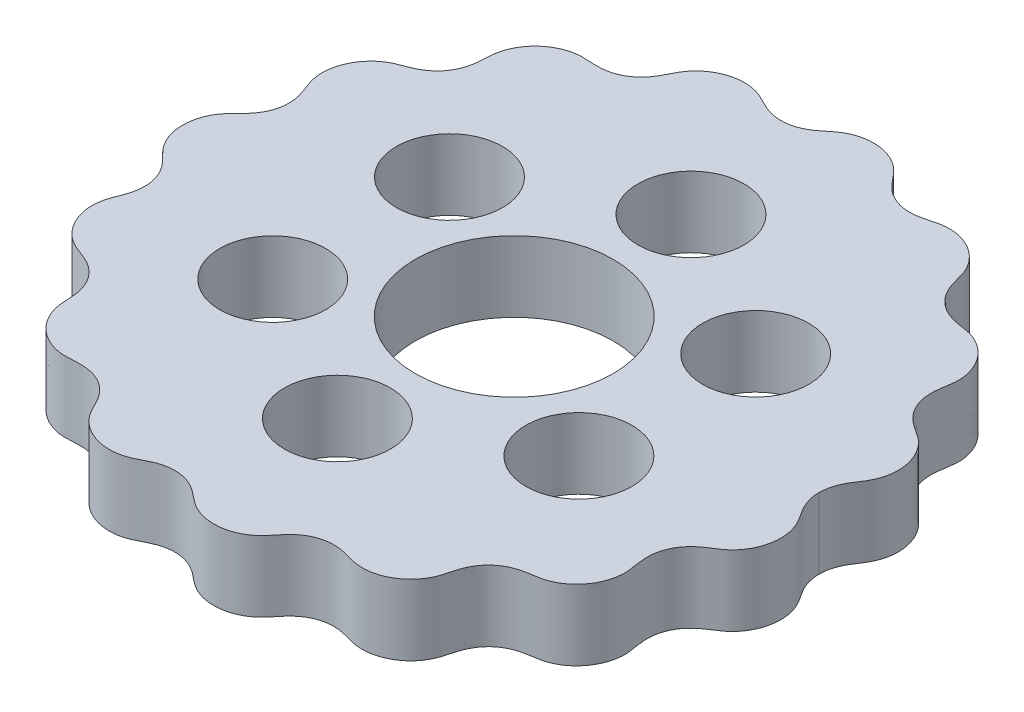
from build123d import *

# Parameters (mm, degrees)
BOSS_EXTRUDE1_DEPTH = 10
SKETCH2_R           = 14
SKETCH2_R_2         = 7.5
CUT_EXTRUDE1_DEPTH  = 10


with BuildPart() as part:
    # Sketch1 → Boss-Extrude1 (new body)
    with BuildSketch(Plane(origin=(0, 0, 0), x_dir=(1, 0, 0), z_dir=(0, 1, 0))):
        with BuildLine():
            add(Edge.make_bspline(
                [(43.125, 0), (43.125, -0.04253376), (43.125842023, -0.105329029), (43.128648775, -0.219501248), (43.135019123, -0.352292602), (43.141932928, -0.454759474), (43.15293713, -0.582006478), (43.169926456, -0.737698323), (43.195057818, -0.920018582), (43.230988459, -1.126003403), (43.274023628, -1.331077263), (43.33656904, -1.585225597), (43.454877118, -1.987246867), (43.659957218, -2.526165865), (44.003257795, -3.208529191), (44.486703726, -3.963009603), (45.011710901, -4.724365647), (45.464881913, -5.566998571), (45.829789729, -6.583473472), (46.037635432, -7.769953603), (46.018876274, -9.108172689), (45.699173049, -10.541997716), (45.13241202, -11.790586356), (44.391420513, -12.821058061), (43.553658534, -13.62486626), (42.686773685, -14.218656762), (41.847173706, -14.723738241), (41.113010158, -15.27010197), (40.356508237, -15.984911286), (39.64401467, -16.920938383), (39.065487742, -18.176194843), (38.821808048, -19.614860862), (38.883740817, -20.808738979), (39.036511831, -21.728716893), (39.149999061, -22.395010733), (39.218485568, -22.931744545), (39.256494717, -23.607184213), (39.20773201, -24.529298073), (38.956646376, -25.675266369), (38.383638085, -26.966438066), (37.491280365, -28.188034586), (36.456233226, -29.112194815), (35.371495342, -29.751280862), (34.300362256, -30.144907835), (33.296839208, -30.340567925), (32.34235617, -30.45668892), (31.455433855, -30.643043045), (30.650677042, -30.910490339), (29.936591375, -31.250491088), (29.11286761, -31.781933535), (28.252053762, -32.581040774), (27.616924672, -33.501658002), (27.196078853, -34.46335063), (26.957088965, -35.223334671), (26.81673532, -35.752261367), (26.683233633, -36.282678413), (26.531216493, -36.808512671), (26.297110502, -37.451705898), (25.883256178, -38.290560319), (25.188270048, -39.256343387), (24.124812446, -40.230448913), (22.778201742, -41.008012636), (21.402888244, -41.44171185), (20.21887944, -41.561053404), (19.285736569, -41.499490672), (18.47628618, -41.357950231), (17.68481965, -41.139805876), (16.656909007, -40.841140025), (15.342614716, -40.657065554), (13.891256715, -40.773177402), (12.591917321, -41.237982668), (11.591762454, -41.868412598), (10.809846945, -42.562675581), (10.205148907, -43.237679616), (9.62724817, -44.006173799), (8.95609046, -44.777447386), (8.079608407, -45.508249162), (6.983789251, -46.128124512), (5.665910241, -46.562416571), (4.161803775, -46.724425993), (2.757108076, -46.575077706), (1.639130281, -46.219541522), (0.816173285, -45.800713485), (0.250230967, -45.430077279), (-0.180351589, -45.102399012), (-0.700634877, -44.670969398), (-1.420974084, -44.078676847), (-2.423935916, -43.428102369), (-3.791697811, -42.919802312), (-5.168044297, -42.793192865), (-6.334915625, -42.942217189), (-7.332207563, -43.239961851), (-8.172458729, -43.602585529), (-9.029663207, -44.077157208), (-9.977356856, -44.531010068), (-11.0923363, -44.854623518), (-12.355278272, -44.98111416), (-13.737494876, -44.845914812), (-15.171813178, -44.390479958), (-16.39183502, -43.692656976), (-17.269283362, -42.922687499), (-17.853346372, -42.213210816), (-18.222154822, -41.649928431), (-18.48392233, -41.179315476), (-18.783866284, -40.577170893), (-19.19551646, -39.74553523), (-19.834531711, -38.742366458), (-20.862240201, -37.71220112), (-22.228604102, -36.923330554), (-23.6346077, -36.548391563), (-24.822884966, -36.496572508), (-25.748927665, -36.55589083), (-26.420372148, -36.597204037), (-26.958818676, -36.605813203), (-27.631039756, -36.568056908), (-28.537496092, -36.416981846), (-29.64303339, -36.04207403), (-30.857376741, -35.334415612), (-31.968954045, -34.319976953), (-32.777148417, -33.190541935), (-33.299075294, -32.033556783), (-33.576307547, -30.906149533), (-33.657106265, -29.85849633), (-33.674717375, -28.878849634), (-33.780801638, -27.969858942), (-34.02159317, -26.957306454), (-34.475969978, -25.872254085), (-35.273790229, -24.743607776), (-36.397871921, -23.813241276), (-37.46276689, -23.269938061), (-38.335876844, -22.94225233), (-38.969647574, -22.707388509), (-39.468716405, -22.498332367), (-40.072668176, -22.193529794), (-40.846862001, -21.690242557), (-41.713754922, -20.899812792), (-42.545441183, -19.757985818), (-43.157191622, -18.374385154), (-43.440020903, -17.015924787), (-43.451106264, -15.75697615), (-43.256448335, -14.632525841), (-42.9240971, -13.665636507), (-42.547488448, -12.78093696), (-42.265303916, -11.9197138), (-42.05495271, -10.89547875), (-42.016706106, -9.908186807), (-42.151176327, -8.933043452), (-42.451756736, -8.004318322), (-42.782221005, -7.303895351), (-43.24001438, -6.582366244), (-43.837169383, -5.861382973), (-44.470557981, -5.254411711), (-45.055286307, -4.678236723), (-45.494411749, -4.152537393), (-45.811419257, -3.706270708), (-46.068393708, -3.268571236), (-46.274068237, -2.849742032), (-46.435847202, -2.455249672), (-46.561708447, -2.09053676), (-46.653497015, -1.76554208), (-46.719145848, -1.483772319), (-46.765092539, -1.247079973), (-46.796615034, -1.056810016), (-46.822884874, -0.865953903), (-46.843904414, -0.673173674), (-46.857699771, -0.506964881), (-46.866240226, -0.363599971), (-46.871167554, -0.236183528), (-46.873795508, -0.132018435), (-46.874781002, -0.061861362), (-46.875, -0.020519481), (-46.875, 0)],
                knots=[0.073379942, 0.073379942, 0.073379942, 0.073379942, 0.073379942, 0.074471538, 0.075017335, 0.075563133, 0.076134945, 0.076706758, 0.077850382, 0.078994007, 0.080137631, 0.081281256, 0.082424881, 0.08471213, 0.089286628, 0.093861126, 0.099069298, 0.104277469, 0.109485641, 0.114693812, 0.122572784, 0.130451757, 0.138511613, 0.146571469, 0.152296032, 0.158020594, 0.163745157, 0.169469719, 0.173712688, 0.177955657, 0.186441594, 0.195001278, 0.203560962, 0.20946737, 0.212420574, 0.215373778, 0.218326982, 0.221280186, 0.227186594, 0.235488461, 0.243790327, 0.251894239, 0.259998151, 0.26556746, 0.271136768, 0.276706077, 0.282275385, 0.286582441, 0.290889497, 0.295196553, 0.299503609, 0.307939116, 0.316374624, 0.319362447, 0.322350271, 0.325338094, 0.328325918, 0.331313742, 0.334301565, 0.340277212, 0.348703072, 0.357128932, 0.365554792, 0.373980652, 0.379956299, 0.382944123, 0.385931946, 0.391907594, 0.397883241, 0.406318748, 0.414754256, 0.423368367, 0.427675423, 0.431982479, 0.437551788, 0.443121096, 0.448690405, 0.454259714, 0.462363625, 0.470467537, 0.478769404, 0.48707127, 0.492977678, 0.495930882, 0.498884086, 0.50183729, 0.504790494, 0.510696902, 0.519256586, 0.527816271, 0.536302208, 0.540545176, 0.544788145, 0.550512708, 0.55623727, 0.561961833, 0.567686395, 0.575746252, 0.583806108, 0.59206794, 0.600329772, 0.606207918, 0.609146991, 0.612086064, 0.615025138, 0.617964211, 0.623842357, 0.632360151, 0.640877945, 0.649395738, 0.657913532, 0.663791678, 0.666730752, 0.669669825, 0.672608898, 0.675547971, 0.681426118, 0.68968795, 0.697949782, 0.706009638, 0.714069494, 0.719794057, 0.725518619, 0.731243182, 0.736967744, 0.741210713, 0.745453681, 0.753939619, 0.762499303, 0.771058987, 0.776965395, 0.779918599, 0.782871803, 0.785825007, 0.788778211, 0.794684619, 0.802986486, 0.811288352, 0.819392264, 0.827496176, 0.833065484, 0.838634793, 0.844204102, 0.84977341, 0.854080466, 0.858387522, 0.867001634, 0.871219387, 0.875437141, 0.879654895, 0.883872649, 0.889848296, 0.895823943, 0.898811766, 0.90179959, 0.904787413, 0.907775237, 0.909881702, 0.911988167, 0.914094632, 0.916201097, 0.917254329, 0.918307562, 0.919360794, 0.920414027, 0.92146726, 0.922520492, 0.923047108, 0.923573725, 0.924100341, 0.924626957, 0.924626957, 0.924626957, 0.924626957, 0.924626957], degree=4))
            add(Edge.make_bspline(
                [(43.125, 0), (43.125, 0.04253376), (43.125842023, 0.105329029), (43.128648775, 0.219501248), (43.135019123, 0.352292602), (43.141932928, 0.454759474), (43.15293713, 0.582006478), (43.169926456, 0.737698323), (43.195057818, 0.920018582), (43.230988459, 1.126003403), (43.274023628, 1.331077263), (43.33656904, 1.585225597), (43.454877118, 1.987246867), (43.659957218, 2.526165865), (44.003257795, 3.208529191), (44.486703726, 3.963009603), (45.011710901, 4.724365647), (45.464881913, 5.566998571), (45.829789729, 6.583473472), (46.037635432, 7.769953603), (46.018876274, 9.108172689), (45.699173049, 10.541997716), (45.13241202, 11.790586356), (44.391420513, 12.821058061), (43.553658534, 13.62486626), (42.686773685, 14.218656762), (41.847173706, 14.723738241), (41.113010158, 15.27010197), (40.356508237, 15.984911286), (39.64401467, 16.920938383), (39.065487742, 18.176194843), (38.821808048, 19.614860862), (38.883740817, 20.808738979), (39.036511831, 21.728716893), (39.149999061, 22.395010733), (39.218485568, 22.931744545), (39.256494717, 23.607184213), (39.20773201, 24.529298073), (38.956646376, 25.675266369), (38.383638085, 26.966438066), (37.491280365, 28.188034586), (36.456233226, 29.112194815), (35.371495342, 29.751280862), (34.300362256, 30.144907835), (33.296839208, 30.340567925), (32.34235617, 30.45668892), (31.455433855, 30.643043045), (30.650677042, 30.910490339), (29.936591375, 31.250491088), (29.11286761, 31.781933535), (28.252053762, 32.581040774), (27.616924672, 33.501658002), (27.196078853, 34.46335063), (26.957088965, 35.223334671), (26.81673532, 35.752261367), (26.683233633, 36.282678413), (26.531216493, 36.808512671), (26.297110502, 37.451705898), (25.883256178, 38.290560319), (25.188270048, 39.256343387), (24.124812446, 40.230448913), (22.778201742, 41.008012636), (21.402888244, 41.44171185), (20.21887944, 41.561053404), (19.285736569, 41.499490672), (18.47628618, 41.357950231), (17.68481965, 41.139805876), (16.656909007, 40.841140025), (15.342614716, 40.657065554), (13.891256715, 40.773177402), (12.591917321, 41.237982668), (11.591762454, 41.868412598), (10.809846945, 42.562675581), (10.205148907, 43.237679616), (9.62724817, 44.006173799), (8.95609046, 44.777447386), (8.079608407, 45.508249162), (6.983789251, 46.128124512), (5.665910241, 46.562416571), (4.161803775, 46.724425993), (2.757108076, 46.575077706), (1.639130281, 46.219541522), (0.816173285, 45.800713485), (0.250230967, 45.430077279), (-0.180351589, 45.102399012), (-0.700634877, 44.670969398), (-1.420974084, 44.078676847), (-2.423935916, 43.428102369), (-3.791697811, 42.919802312), (-5.168044297, 42.793192865), (-6.334915625, 42.942217189), (-7.332207563, 43.239961851), (-8.172458729, 43.602585529), (-9.029663207, 44.077157208), (-9.977356856, 44.531010068), (-11.0923363, 44.854623518), (-12.355278272, 44.98111416), (-13.737494876, 44.845914812), (-15.171813178, 44.390479958), (-16.39183502, 43.692656976), (-17.269283362, 42.922687499), (-17.853346372, 42.213210816), (-18.222154822, 41.649928431), (-18.48392233, 41.179315476), (-18.783866284, 40.577170893), (-19.19551646, 39.74553523), (-19.834531711, 38.742366458), (-20.862240201, 37.71220112), (-22.228604102, 36.923330554), (-23.6346077, 36.548391563), (-24.822884966, 36.496572508), (-25.748927665, 36.55589083), (-26.420372148, 36.597204037), (-26.958818676, 36.605813203), (-27.631039756, 36.568056908), (-28.537496092, 36.416981846), (-29.64303339, 36.04207403), (-30.857376741, 35.334415612), (-31.968954045, 34.319976953), (-32.777148417, 33.190541935), (-33.299075294, 32.033556783), (-33.576307547, 30.906149533), (-33.657106265, 29.85849633), (-33.674717375, 28.878849634), (-33.780801638, 27.969858942), (-34.02159317, 26.957306454), (-34.475969978, 25.872254085), (-35.273790229, 24.743607776), (-36.397871921, 23.813241276), (-37.46276689, 23.269938061), (-38.335876844, 22.94225233), (-38.969647574, 22.707388509), (-39.468716405, 22.498332367), (-40.072668176, 22.193529794), (-40.846862001, 21.690242557), (-41.713754922, 20.899812792), (-42.545441183, 19.757985818), (-43.157191622, 18.374385154), (-43.440020903, 17.015924787), (-43.451106264, 15.75697615), (-43.256448335, 14.632525841), (-42.9240971, 13.665636507), (-42.547488448, 12.78093696), (-42.265303916, 11.9197138), (-42.05495271, 10.89547875), (-42.016706106, 9.908186807), (-42.151176327, 8.933043452), (-42.451756736, 8.004318322), (-42.782221005, 7.303895351), (-43.24001438, 6.582366244), (-43.837169383, 5.861382973), (-44.470557981, 5.254411711), (-45.055286307, 4.678236723), (-45.494411749, 4.152537393), (-45.811419257, 3.706270708), (-46.068393708, 3.268571236), (-46.274068237, 2.849742032), (-46.435847202, 2.455249672), (-46.561708447, 2.09053676), (-46.653497015, 1.76554208), (-46.719145848, 1.483772319), (-46.765092539, 1.247079973), (-46.796615034, 1.056810016), (-46.822884874, 0.865953903), (-46.843904414, 0.673173674), (-46.857699771, 0.506964881), (-46.866240226, 0.363599971), (-46.871167554, 0.236183528), (-46.873795508, 0.132018435), (-46.874781002, 0.061861362), (-46.875, 0.020519481), (-46.875, 0)],
                knots=[0.073379942, 0.073379942, 0.073379942, 0.073379942, 0.073379942, 0.074471538, 0.075017335, 0.075563133, 0.076134945, 0.076706758, 0.077850382, 0.078994007, 0.080137631, 0.081281256, 0.082424881, 0.08471213, 0.089286628, 0.093861126, 0.099069298, 0.104277469, 0.109485641, 0.114693812, 0.122572784, 0.130451757, 0.138511613, 0.146571469, 0.152296032, 0.158020594, 0.163745157, 0.169469719, 0.173712688, 0.177955657, 0.186441594, 0.195001278, 0.203560962, 0.20946737, 0.212420574, 0.215373778, 0.218326982, 0.221280186, 0.227186594, 0.235488461, 0.243790327, 0.251894239, 0.259998151, 0.26556746, 0.271136768, 0.276706077, 0.282275385, 0.286582441, 0.290889497, 0.295196553, 0.299503609, 0.307939116, 0.316374624, 0.319362447, 0.322350271, 0.325338094, 0.328325918, 0.331313742, 0.334301565, 0.340277212, 0.348703072, 0.357128932, 0.365554792, 0.373980652, 0.379956299, 0.382944123, 0.385931946, 0.391907594, 0.397883241, 0.406318748, 0.414754256, 0.423368367, 0.427675423, 0.431982479, 0.437551788, 0.443121096, 0.448690405, 0.454259714, 0.462363625, 0.470467537, 0.478769404, 0.48707127, 0.492977678, 0.495930882, 0.498884086, 0.50183729, 0.504790494, 0.510696902, 0.519256586, 0.527816271, 0.536302208, 0.540545176, 0.544788145, 0.550512708, 0.55623727, 0.561961833, 0.567686395, 0.575746252, 0.583806108, 0.59206794, 0.600329772, 0.606207918, 0.609146991, 0.612086064, 0.615025138, 0.617964211, 0.623842357, 0.632360151, 0.640877945, 0.649395738, 0.657913532, 0.663791678, 0.666730752, 0.669669825, 0.672608898, 0.675547971, 0.681426118, 0.68968795, 0.697949782, 0.706009638, 0.714069494, 0.719794057, 0.725518619, 0.731243182, 0.736967744, 0.741210713, 0.745453681, 0.753939619, 0.762499303, 0.771058987, 0.776965395, 0.779918599, 0.782871803, 0.785825007, 0.788778211, 0.794684619, 0.802986486, 0.811288352, 0.819392264, 0.827496176, 0.833065484, 0.838634793, 0.844204102, 0.84977341, 0.854080466, 0.858387522, 0.867001634, 0.871219387, 0.875437141, 0.879654895, 0.883872649, 0.889848296, 0.895823943, 0.898811766, 0.90179959, 0.904787413, 0.907775237, 0.909881702, 0.911988167, 0.914094632, 0.916201097, 0.917254329, 0.918307562, 0.919360794, 0.920414027, 0.92146726, 0.922520492, 0.923047108, 0.923573725, 0.924100341, 0.924626957, 0.924626957, 0.924626957, 0.924626957, 0.924626957], degree=4))
        make_face()
    extrude(amount=BOSS_EXTRUDE1_DEPTH)

    # Sketch2 → Cut-Extrude1 (cut)
    with BuildSketch(Plane(origin=(0, 10, 0), x_dir=(1, 0, 0), z_dir=(0, 1, 0))):
        Circle(SKETCH2_R)
        with Locations((0, 25)):
            Circle(SKETCH2_R_2)
        with Locations((21.650635095, 12.5)):
            Circle(SKETCH2_R_2)
        with Locations((21.650635095, -12.5)):
            Circle(SKETCH2_R_2)
        with Locations((0, -25)):
            Circle(SKETCH2_R_2)
        with Locations((-21.650635095, -12.5)):
            Circle(SKETCH2_R_2)
        with Locations((-21.650635095, 12.5)):
            Circle(SKETCH2_R_2)
    extrude(amount=-CUT_EXTRUDE1_DEPTH, mode=Mode.SUBTRACT)


solid = part.part
